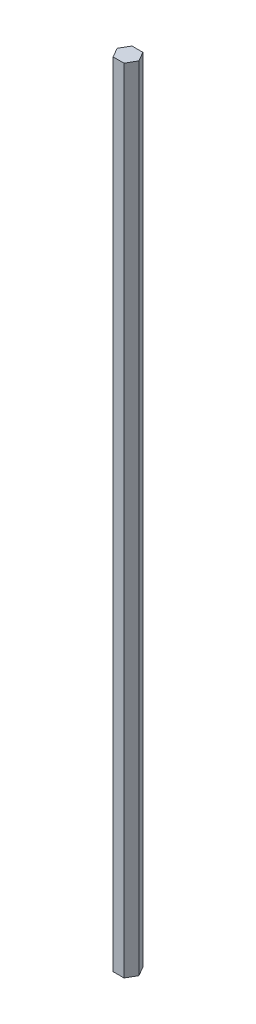
from build123d import *

# Parameters (mm, degrees)
BOSS_EXTRUDE1_DEPTH = 533.4


with BuildPart() as part:
    # Sketch1 → Boss-Extrude1 (new body)
    with BuildSketch(Plane(origin=(0, 0, 0), x_dir=(1, 0, 0), z_dir=(0, 1, 0))):
        Polygon((7.332348419, 0), (3.666174209, 6.35), (-3.666174209, 6.35), (-7.332348419, 0), (-3.666174209, -6.35), (3.666174209, -6.35), align=None)
    extrude(amount=BOSS_EXTRUDE1_DEPTH)


solid = part.part
